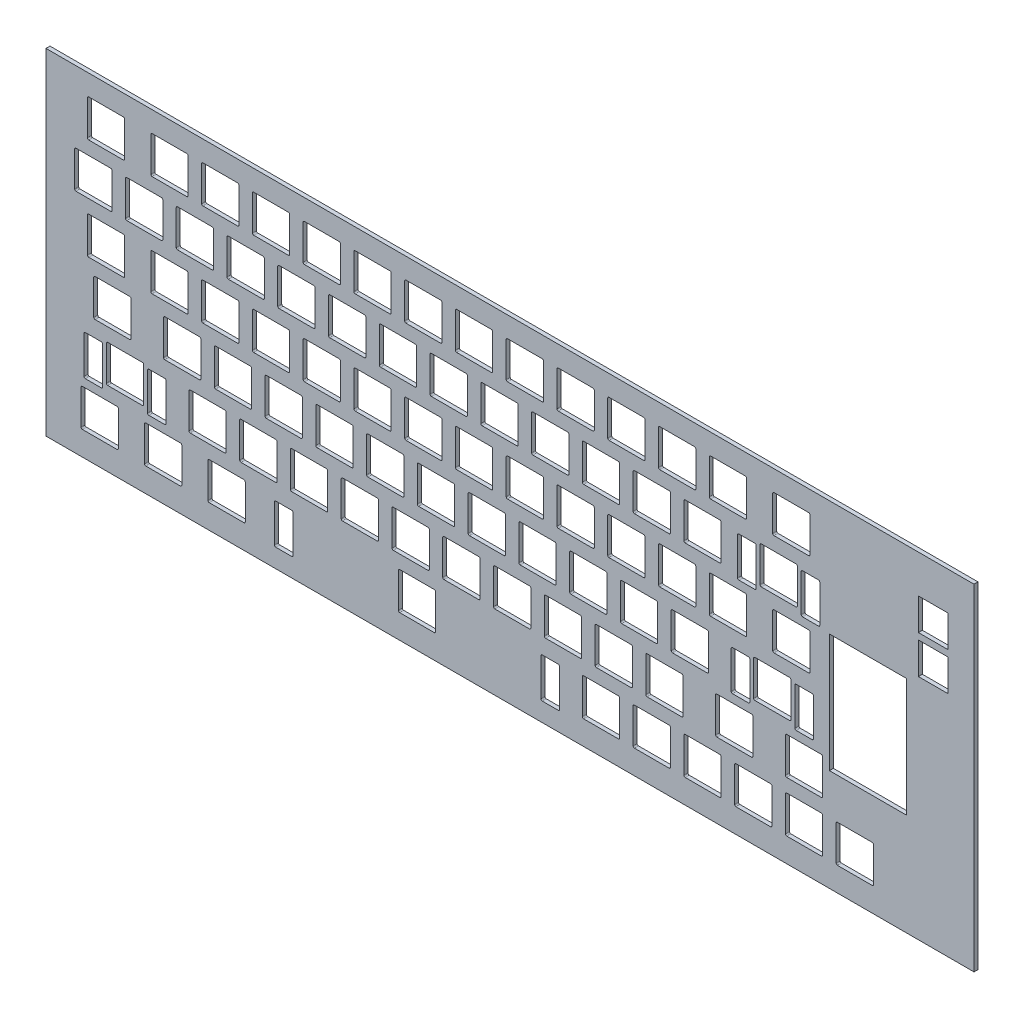
from build123d import *

# Parameters (mm, degrees)
SKETCH6_W           = 340
SKETCH6_H           = 114.3
SKETCH6_W_2         = 29
SKETCH6_H_2         = 44.42
SKETCH6_W_3         = 11.05
SKETCH6_H_3         = 11.9
BOSS_EXTRUDE4_DEPTH = 1.5
SKETCH7_W           = 1.5
SKETCH7_H           = 114.3
BOSS_EXTRUDE5_DEPTH = 8.24
SKETCH8_W           = 348.24
SKETCH8_H           = 1.5
BOSS_EXTRUDE6_DEPTH = 6.48
SKETCH9_W           = 348.24
SKETCH9_H           = 1.5
BOSS_EXTRUDE7_DEPTH = 5.23


with BuildPart() as part:
    # Sketch6 → Boss-Extrude4 (new body)
    with BuildSketch(Plane.XY):
        with Locations((170, -57.15)):
            Rectangle(SKETCH6_W, SKETCH6_H)
        with BuildLine():
            Line((7.7875, -2.525), (20.7875, -2.525))
            ThreePointArc((20.7875, -2.525), (21.141053391, -2.671446609), (21.2875, -3.025))
            Line((21.2875, -3.025), (21.2875, -16.025))
            ThreePointArc((21.2875, -16.025), (21.141053391, -16.378553391), (20.7875, -16.525))
            Line((20.7875, -16.525), (7.7875, -16.525))
            ThreePointArc((7.7875, -16.525), (7.433946609, -16.378553391), (7.2875, -16.025))
            Line((7.2875, -16.025), (7.2875, -3.025))
            ThreePointArc((7.2875, -3.025), (7.433946609, -2.671446609), (7.7875, -2.525))
        make_face(mode=Mode.SUBTRACT)
        with BuildLine():
            Line((31.6, -2.525), (44.6, -2.525))
            ThreePointArc((44.6, -2.525), (44.953553391, -2.671446609), (45.1, -3.025))
            Line((45.1, -3.025), (45.1, -16.025))
            ThreePointArc((45.1, -16.025), (44.953553391, -16.378553391), (44.6, -16.525))
            Line((44.6, -16.525), (31.6, -16.525))
            ThreePointArc((31.6, -16.525), (31.246446609, -16.378553391), (31.1, -16.025))
            Line((31.1, -16.025), (31.1, -3.025))
            ThreePointArc((31.1, -3.025), (31.246446609, -2.671446609), (31.6, -2.525))
        make_face(mode=Mode.SUBTRACT)
        with BuildLine():
            Line((50.65, -2.525), (63.65, -2.525))
            ThreePointArc((63.65, -2.525), (64.003553391, -2.671446609), (64.15, -3.025))
            Line((64.15, -3.025), (64.15, -16.025))
            ThreePointArc((64.15, -16.025), (64.003553391, -16.378553391), (63.65, -16.525))
            Line((63.65, -16.525), (50.65, -16.525))
            ThreePointArc((50.65, -16.525), (50.296446609, -16.378553391), (50.15, -16.025))
            Line((50.15, -16.025), (50.15, -3.025))
            ThreePointArc((50.15, -3.025), (50.296446609, -2.671446609), (50.65, -2.525))
        make_face(mode=Mode.SUBTRACT)
        with BuildLine():
            Line((69.7, -2.525), (82.7, -2.525))
            ThreePointArc((82.7, -2.525), (83.053553391, -2.671446609), (83.2, -3.025))
            Line((83.2, -3.025), (83.2, -16.025))
            ThreePointArc((83.2, -16.025), (83.053553391, -16.378553391), (82.7, -16.525))
            Line((82.7, -16.525), (69.7, -16.525))
            ThreePointArc((69.7, -16.525), (69.346446609, -16.378553391), (69.2, -16.025))
            Line((69.2, -16.025), (69.2, -3.025))
            ThreePointArc((69.2, -3.025), (69.346446609, -2.671446609), (69.7, -2.525))
        make_face(mode=Mode.SUBTRACT)
        with BuildLine():
            Line((88.75, -2.525), (101.75, -2.525))
            ThreePointArc((101.75, -2.525), (102.103553391, -2.671446609), (102.25, -3.025))
            Line((102.25, -3.025), (102.25, -16.025))
            ThreePointArc((102.25, -16.025), (102.103553391, -16.378553391), (101.75, -16.525))
            Line((101.75, -16.525), (88.75, -16.525))
            ThreePointArc((88.75, -16.525), (88.396446609, -16.378553391), (88.25, -16.025))
            Line((88.25, -16.025), (88.25, -3.025))
            ThreePointArc((88.25, -3.025), (88.396446609, -2.671446609), (88.75, -2.525))
        make_face(mode=Mode.SUBTRACT)
        with BuildLine():
            Line((107.8, -2.525), (120.8, -2.525))
            ThreePointArc((120.8, -2.525), (121.153553391, -2.671446609), (121.3, -3.025))
            Line((121.3, -3.025), (121.3, -16.025))
            ThreePointArc((121.3, -16.025), (121.153553391, -16.378553391), (120.8, -16.525))
            Line((120.8, -16.525), (107.8, -16.525))
            ThreePointArc((107.8, -16.525), (107.446446609, -16.378553391), (107.3, -16.025))
            Line((107.3, -16.025), (107.3, -3.025))
            ThreePointArc((107.3, -3.025), (107.446446609, -2.671446609), (107.8, -2.525))
        make_face(mode=Mode.SUBTRACT)
        with BuildLine():
            Line((126.85, -2.525), (139.85, -2.525))
            ThreePointArc((139.85, -2.525), (140.203553391, -2.671446609), (140.35, -3.025))
            Line((140.35, -3.025), (140.35, -16.025))
            ThreePointArc((140.35, -16.025), (140.203553391, -16.378553391), (139.85, -16.525))
            Line((139.85, -16.525), (126.85, -16.525))
            ThreePointArc((126.85, -16.525), (126.496446609, -16.378553391), (126.35, -16.025))
            Line((126.35, -16.025), (126.35, -3.025))
            ThreePointArc((126.35, -3.025), (126.496446609, -2.671446609), (126.85, -2.525))
        make_face(mode=Mode.SUBTRACT)
        with BuildLine():
            Line((145.9, -2.525), (158.9, -2.525))
            ThreePointArc((158.9, -2.525), (159.253553391, -2.671446609), (159.4, -3.025))
            Line((159.4, -3.025), (159.4, -16.025))
            ThreePointArc((159.4, -16.025), (159.253553391, -16.378553391), (158.9, -16.525))
            Line((158.9, -16.525), (145.9, -16.525))
            ThreePointArc((145.9, -16.525), (145.546446609, -16.378553391), (145.4, -16.025))
            Line((145.4, -16.025), (145.4, -3.025))
            ThreePointArc((145.4, -3.025), (145.546446609, -2.671446609), (145.9, -2.525))
        make_face(mode=Mode.SUBTRACT)
        with BuildLine():
            Line((164.95, -2.525), (177.95, -2.525))
            ThreePointArc((177.95, -2.525), (178.303553391, -2.671446609), (178.45, -3.025))
            Line((178.45, -3.025), (178.45, -16.025))
            ThreePointArc((178.45, -16.025), (178.303553391, -16.378553391), (177.95, -16.525))
            Line((177.95, -16.525), (164.95, -16.525))
            ThreePointArc((164.95, -16.525), (164.596446609, -16.378553391), (164.45, -16.025))
            Line((164.45, -16.025), (164.45, -3.025))
            ThreePointArc((164.45, -3.025), (164.596446609, -2.671446609), (164.95, -2.525))
        make_face(mode=Mode.SUBTRACT)
        with BuildLine():
            Line((184, -2.525), (197, -2.525))
            ThreePointArc((197, -2.525), (197.353553391, -2.671446609), (197.5, -3.025))
            Line((197.5, -3.025), (197.5, -16.025))
            ThreePointArc((197.5, -16.025), (197.353553391, -16.378553391), (197, -16.525))
            Line((197, -16.525), (184, -16.525))
            ThreePointArc((184, -16.525), (183.646446609, -16.378553391), (183.5, -16.025))
            Line((183.5, -16.025), (183.5, -3.025))
            ThreePointArc((183.5, -3.025), (183.646446609, -2.671446609), (184, -2.525))
        make_face(mode=Mode.SUBTRACT)
        with BuildLine():
            Line((203.05, -2.525), (216.05, -2.525))
            ThreePointArc((216.05, -2.525), (216.403553391, -2.671446609), (216.55, -3.025))
            Line((216.55, -3.025), (216.55, -16.025))
            ThreePointArc((216.55, -16.025), (216.403553391, -16.378553391), (216.05, -16.525))
            Line((216.05, -16.525), (203.05, -16.525))
            ThreePointArc((203.05, -16.525), (202.696446609, -16.378553391), (202.55, -16.025))
            Line((202.55, -16.025), (202.55, -3.025))
            ThreePointArc((202.55, -3.025), (202.696446609, -2.671446609), (203.05, -2.525))
        make_face(mode=Mode.SUBTRACT)
        with BuildLine():
            Line((222.1, -2.525), (235.1, -2.525))
            ThreePointArc((235.1, -2.525), (235.453553391, -2.671446609), (235.6, -3.025))
            Line((235.6, -3.025), (235.6, -16.025))
            ThreePointArc((235.6, -16.025), (235.453553391, -16.378553391), (235.1, -16.525))
            Line((235.1, -16.525), (222.1, -16.525))
            ThreePointArc((222.1, -16.525), (221.746446609, -16.378553391), (221.6, -16.025))
            Line((221.6, -16.025), (221.6, -3.025))
            ThreePointArc((221.6, -3.025), (221.746446609, -2.671446609), (222.1, -2.525))
        make_face(mode=Mode.SUBTRACT)
        with BuildLine():
            Line((241.15, -2.525), (254.15, -2.525))
            ThreePointArc((254.15, -2.525), (254.503553391, -2.671446609), (254.65, -3.025))
            Line((254.65, -3.025), (254.65, -16.025))
            ThreePointArc((254.65, -16.025), (254.503553391, -16.378553391), (254.15, -16.525))
            Line((254.15, -16.525), (241.15, -16.525))
            ThreePointArc((241.15, -16.525), (240.796446609, -16.378553391), (240.65, -16.025))
            Line((240.65, -16.025), (240.65, -3.025))
            ThreePointArc((240.65, -3.025), (240.796446609, -2.671446609), (241.15, -2.525))
        make_face(mode=Mode.SUBTRACT)
        with BuildLine():
            Line((264.9625, -2.525), (277.9625, -2.525))
            ThreePointArc((277.9625, -2.525), (278.316053391, -2.671446609), (278.4625, -3.025))
            Line((278.4625, -3.025), (278.4625, -16.025))
            ThreePointArc((278.4625, -16.025), (278.316053391, -16.378553391), (277.9625, -16.525))
            Line((277.9625, -16.525), (264.9625, -16.525))
            ThreePointArc((264.9625, -16.525), (264.608946609, -16.378553391), (264.4625, -16.025))
            Line((264.4625, -16.025), (264.4625, -3.025))
            ThreePointArc((264.4625, -3.025), (264.608946609, -2.671446609), (264.9625, -2.525))
        make_face(mode=Mode.SUBTRACT)
        with BuildLine():
            Line((3.025, -21.575), (16.025, -21.575))
            ThreePointArc((16.025, -21.575), (16.378553391, -21.721446609), (16.525, -22.075))
            Line((16.525, -22.075), (16.525, -35.075))
            ThreePointArc((16.525, -35.075), (16.378553391, -35.428553391), (16.025, -35.575))
            Line((16.025, -35.575), (3.025, -35.575))
            ThreePointArc((3.025, -35.575), (2.671446609, -35.428553391), (2.525, -35.075))
            Line((2.525, -35.075), (2.525, -22.075))
            ThreePointArc((2.525, -22.075), (2.671446609, -21.721446609), (3.025, -21.575))
        make_face(mode=Mode.SUBTRACT)
        with BuildLine():
            Line((22.075, -21.575), (35.075, -21.575))
            ThreePointArc((35.075, -21.575), (35.428553391, -21.721446609), (35.575, -22.075))
            Line((35.575, -22.075), (35.575, -35.075))
            ThreePointArc((35.575, -35.075), (35.428553391, -35.428553391), (35.075, -35.575))
            Line((35.075, -35.575), (22.075, -35.575))
            ThreePointArc((22.075, -35.575), (21.721446609, -35.428553391), (21.575, -35.075))
            Line((21.575, -35.075), (21.575, -22.075))
            ThreePointArc((21.575, -22.075), (21.721446609, -21.721446609), (22.075, -21.575))
        make_face(mode=Mode.SUBTRACT)
        with BuildLine():
            Line((41.125, -21.575), (54.125, -21.575))
            ThreePointArc((54.125, -21.575), (54.478553391, -21.721446609), (54.625, -22.075))
            Line((54.625, -22.075), (54.625, -35.075))
            ThreePointArc((54.625, -35.075), (54.478553391, -35.428553391), (54.125, -35.575))
            Line((54.125, -35.575), (41.125, -35.575))
            ThreePointArc((41.125, -35.575), (40.771446609, -35.428553391), (40.625, -35.075))
            Line((40.625, -35.075), (40.625, -22.075))
            ThreePointArc((40.625, -22.075), (40.771446609, -21.721446609), (41.125, -21.575))
        make_face(mode=Mode.SUBTRACT)
        with BuildLine():
            Line((60.175, -21.575), (73.175, -21.575))
            ThreePointArc((73.175, -21.575), (73.528553391, -21.721446609), (73.675, -22.075))
            Line((73.675, -22.075), (73.675, -35.075))
            ThreePointArc((73.675, -35.075), (73.528553391, -35.428553391), (73.175, -35.575))
            Line((73.175, -35.575), (60.175, -35.575))
            ThreePointArc((60.175, -35.575), (59.821446609, -35.428553391), (59.675, -35.075))
            Line((59.675, -35.075), (59.675, -22.075))
            ThreePointArc((59.675, -22.075), (59.821446609, -21.721446609), (60.175, -21.575))
        make_face(mode=Mode.SUBTRACT)
        with BuildLine():
            Line((79.225, -21.575), (92.225, -21.575))
            ThreePointArc((92.225, -21.575), (92.578553391, -21.721446609), (92.725, -22.075))
            Line((92.725, -22.075), (92.725, -35.075))
            ThreePointArc((92.725, -35.075), (92.578553391, -35.428553391), (92.225, -35.575))
            Line((92.225, -35.575), (79.225, -35.575))
            ThreePointArc((79.225, -35.575), (78.871446609, -35.428553391), (78.725, -35.075))
            Line((78.725, -35.075), (78.725, -22.075))
            ThreePointArc((78.725, -22.075), (78.871446609, -21.721446609), (79.225, -21.575))
        make_face(mode=Mode.SUBTRACT)
        with BuildLine():
            Line((98.275, -21.575), (111.275, -21.575))
            ThreePointArc((111.275, -21.575), (111.628553391, -21.721446609), (111.775, -22.075))
            Line((111.775, -22.075), (111.775, -35.075))
            ThreePointArc((111.775, -35.075), (111.628553391, -35.428553391), (111.275, -35.575))
            Line((111.275, -35.575), (98.275, -35.575))
            ThreePointArc((98.275, -35.575), (97.921446609, -35.428553391), (97.775, -35.075))
            Line((97.775, -35.075), (97.775, -22.075))
            ThreePointArc((97.775, -22.075), (97.921446609, -21.721446609), (98.275, -21.575))
        make_face(mode=Mode.SUBTRACT)
        with BuildLine():
            Line((117.325, -21.575), (130.325, -21.575))
            ThreePointArc((130.325, -21.575), (130.678553391, -21.721446609), (130.825, -22.075))
            Line((130.825, -22.075), (130.825, -35.075))
            ThreePointArc((130.825, -35.075), (130.678553391, -35.428553391), (130.325, -35.575))
            Line((130.325, -35.575), (117.325, -35.575))
            ThreePointArc((117.325, -35.575), (116.971446609, -35.428553391), (116.825, -35.075))
            Line((116.825, -35.075), (116.825, -22.075))
            ThreePointArc((116.825, -22.075), (116.971446609, -21.721446609), (117.325, -21.575))
        make_face(mode=Mode.SUBTRACT)
        with BuildLine():
            Line((136.375, -21.575), (149.375, -21.575))
            ThreePointArc((149.375, -21.575), (149.728553391, -21.721446609), (149.875, -22.075))
            Line((149.875, -22.075), (149.875, -35.075))
            ThreePointArc((149.875, -35.075), (149.728553391, -35.428553391), (149.375, -35.575))
            Line((149.375, -35.575), (136.375, -35.575))
            ThreePointArc((136.375, -35.575), (136.021446609, -35.428553391), (135.875, -35.075))
            Line((135.875, -35.075), (135.875, -22.075))
            ThreePointArc((135.875, -22.075), (136.021446609, -21.721446609), (136.375, -21.575))
        make_face(mode=Mode.SUBTRACT)
        with BuildLine():
            Line((155.425, -21.575), (168.425, -21.575))
            ThreePointArc((168.425, -21.575), (168.778553391, -21.721446609), (168.925, -22.075))
            Line((168.925, -22.075), (168.925, -35.075))
            ThreePointArc((168.925, -35.075), (168.778553391, -35.428553391), (168.425, -35.575))
            Line((168.425, -35.575), (155.425, -35.575))
            ThreePointArc((155.425, -35.575), (155.071446609, -35.428553391), (154.925, -35.075))
            Line((154.925, -35.075), (154.925, -22.075))
            ThreePointArc((154.925, -22.075), (155.071446609, -21.721446609), (155.425, -21.575))
        make_face(mode=Mode.SUBTRACT)
        with BuildLine():
            Line((174.475, -21.575), (187.475, -21.575))
            ThreePointArc((187.475, -21.575), (187.828553391, -21.721446609), (187.975, -22.075))
            Line((187.975, -22.075), (187.975, -35.075))
            ThreePointArc((187.975, -35.075), (187.828553391, -35.428553391), (187.475, -35.575))
            Line((187.475, -35.575), (174.475, -35.575))
            ThreePointArc((174.475, -35.575), (174.121446609, -35.428553391), (173.975, -35.075))
            Line((173.975, -35.075), (173.975, -22.075))
            ThreePointArc((173.975, -22.075), (174.121446609, -21.721446609), (174.475, -21.575))
        make_face(mode=Mode.SUBTRACT)
        with BuildLine():
            Line((193.525, -21.575), (206.525, -21.575))
            ThreePointArc((206.525, -21.575), (206.878553391, -21.721446609), (207.025, -22.075))
            Line((207.025, -22.075), (207.025, -35.075))
            ThreePointArc((207.025, -35.075), (206.878553391, -35.428553391), (206.525, -35.575))
            Line((206.525, -35.575), (193.525, -35.575))
            ThreePointArc((193.525, -35.575), (193.171446609, -35.428553391), (193.025, -35.075))
            Line((193.025, -35.075), (193.025, -22.075))
            ThreePointArc((193.025, -22.075), (193.171446609, -21.721446609), (193.525, -21.575))
        make_face(mode=Mode.SUBTRACT)
        with BuildLine():
            Line((212.575, -21.575), (225.575, -21.575))
            ThreePointArc((225.575, -21.575), (225.928553391, -21.721446609), (226.075, -22.075))
            Line((226.075, -22.075), (226.075, -35.075))
            ThreePointArc((226.075, -35.075), (225.928553391, -35.428553391), (225.575, -35.575))
            Line((225.575, -35.575), (212.575, -35.575))
            ThreePointArc((212.575, -35.575), (212.221446609, -35.428553391), (212.075, -35.075))
            Line((212.075, -35.075), (212.075, -22.075))
            ThreePointArc((212.075, -22.075), (212.221446609, -21.721446609), (212.575, -21.575))
        make_face(mode=Mode.SUBTRACT)
        with BuildLine():
            Line((231.625, -21.575), (244.625, -21.575))
            ThreePointArc((244.625, -21.575), (244.978553391, -21.721446609), (245.125, -22.075))
            Line((245.125, -22.075), (245.125, -35.075))
            ThreePointArc((245.125, -35.075), (244.978553391, -35.428553391), (244.625, -35.575))
            Line((244.625, -35.575), (231.625, -35.575))
            ThreePointArc((231.625, -35.575), (231.271446609, -35.428553391), (231.125, -35.075))
            Line((231.125, -35.075), (231.125, -22.075))
            ThreePointArc((231.125, -22.075), (231.271446609, -21.721446609), (231.625, -21.575))
        make_face(mode=Mode.SUBTRACT)
        with BuildLine():
            Line((260.2, -21.575), (273.2, -21.575))
            ThreePointArc((273.2, -21.575), (273.553553391, -21.721446609), (273.7, -22.075))
            Line((273.7, -22.075), (273.7, -35.075))
            ThreePointArc((273.7, -35.075), (273.553553391, -35.428553391), (273.2, -35.575))
            Line((273.2, -35.575), (260.2, -35.575))
            ThreePointArc((260.2, -35.575), (259.846446609, -35.428553391), (259.7, -35.075))
            Line((259.7, -35.075), (259.7, -22.075))
            ThreePointArc((259.7, -22.075), (259.846446609, -21.721446609), (260.2, -21.575))
        make_face(mode=Mode.SUBTRACT)
        with BuildLine():
            Line((251.762, -22.575), (257.762, -22.575))
            ThreePointArc((257.762, -22.575), (258.115553391, -22.721446609), (258.262, -23.075))
            Line((258.262, -23.075), (258.262, -37.075))
            ThreePointArc((258.262, -37.075), (258.115553391, -37.428553391), (257.762, -37.575))
            Line((257.762, -37.575), (251.762, -37.575))
            ThreePointArc((251.762, -37.575), (251.408446609, -37.428553391), (251.262, -37.075))
            Line((251.262, -37.075), (251.262, -23.075))
            ThreePointArc((251.262, -23.075), (251.408446609, -22.721446609), (251.762, -22.575))
        make_face(mode=Mode.SUBTRACT)
        with BuildLine():
            Line((275.638, -22.575), (281.638, -22.575))
            ThreePointArc((281.638, -22.575), (281.991553391, -22.721446609), (282.138, -23.075))
            Line((282.138, -23.075), (282.138, -37.075))
            ThreePointArc((282.138, -37.075), (281.991553391, -37.428553391), (281.638, -37.575))
            Line((281.638, -37.575), (275.638, -37.575))
            ThreePointArc((275.638, -37.575), (275.284446609, -37.428553391), (275.138, -37.075))
            Line((275.138, -37.075), (275.138, -23.075))
            ThreePointArc((275.138, -23.075), (275.284446609, -22.721446609), (275.638, -22.575))
        make_face(mode=Mode.SUBTRACT)
        with BuildLine():
            Line((7.7875, -40.625), (20.7875, -40.625))
            ThreePointArc((20.7875, -40.625), (21.141053391, -40.771446609), (21.2875, -41.125))
            Line((21.2875, -41.125), (21.2875, -54.125))
            ThreePointArc((21.2875, -54.125), (21.141053391, -54.478553391), (20.7875, -54.625))
            Line((20.7875, -54.625), (7.7875, -54.625))
            ThreePointArc((7.7875, -54.625), (7.433946609, -54.478553391), (7.2875, -54.125))
            Line((7.2875, -54.125), (7.2875, -41.125))
            ThreePointArc((7.2875, -41.125), (7.433946609, -40.771446609), (7.7875, -40.625))
        make_face(mode=Mode.SUBTRACT)
        with BuildLine():
            Line((31.6, -40.625), (44.6, -40.625))
            ThreePointArc((44.6, -40.625), (44.953553391, -40.771446609), (45.1, -41.125))
            Line((45.1, -41.125), (45.1, -54.125))
            ThreePointArc((45.1, -54.125), (44.953553391, -54.478553391), (44.6, -54.625))
            Line((44.6, -54.625), (31.6, -54.625))
            ThreePointArc((31.6, -54.625), (31.246446609, -54.478553391), (31.1, -54.125))
            Line((31.1, -54.125), (31.1, -41.125))
            ThreePointArc((31.1, -41.125), (31.246446609, -40.771446609), (31.6, -40.625))
        make_face(mode=Mode.SUBTRACT)
        with BuildLine():
            Line((50.65, -40.625), (63.65, -40.625))
            ThreePointArc((63.65, -40.625), (64.003553391, -40.771446609), (64.15, -41.125))
            Line((64.15, -41.125), (64.15, -54.125))
            ThreePointArc((64.15, -54.125), (64.003553391, -54.478553391), (63.65, -54.625))
            Line((63.65, -54.625), (50.65, -54.625))
            ThreePointArc((50.65, -54.625), (50.296446609, -54.478553391), (50.15, -54.125))
            Line((50.15, -54.125), (50.15, -41.125))
            ThreePointArc((50.15, -41.125), (50.296446609, -40.771446609), (50.65, -40.625))
        make_face(mode=Mode.SUBTRACT)
        with BuildLine():
            Line((69.7, -40.625), (82.7, -40.625))
            ThreePointArc((82.7, -40.625), (83.053553391, -40.771446609), (83.2, -41.125))
            Line((83.2, -41.125), (83.2, -54.125))
            ThreePointArc((83.2, -54.125), (83.053553391, -54.478553391), (82.7, -54.625))
            Line((82.7, -54.625), (69.7, -54.625))
            ThreePointArc((69.7, -54.625), (69.346446609, -54.478553391), (69.2, -54.125))
            Line((69.2, -54.125), (69.2, -41.125))
            ThreePointArc((69.2, -41.125), (69.346446609, -40.771446609), (69.7, -40.625))
        make_face(mode=Mode.SUBTRACT)
        with BuildLine():
            Line((88.75, -40.625), (101.75, -40.625))
            ThreePointArc((101.75, -40.625), (102.103553391, -40.771446609), (102.25, -41.125))
            Line((102.25, -41.125), (102.25, -54.125))
            ThreePointArc((102.25, -54.125), (102.103553391, -54.478553391), (101.75, -54.625))
            Line((101.75, -54.625), (88.75, -54.625))
            ThreePointArc((88.75, -54.625), (88.396446609, -54.478553391), (88.25, -54.125))
            Line((88.25, -54.125), (88.25, -41.125))
            ThreePointArc((88.25, -41.125), (88.396446609, -40.771446609), (88.75, -40.625))
        make_face(mode=Mode.SUBTRACT)
        with BuildLine():
            Line((107.8, -40.625), (120.8, -40.625))
            ThreePointArc((120.8, -40.625), (121.153553391, -40.771446609), (121.3, -41.125))
            Line((121.3, -41.125), (121.3, -54.125))
            ThreePointArc((121.3, -54.125), (121.153553391, -54.478553391), (120.8, -54.625))
            Line((120.8, -54.625), (107.8, -54.625))
            ThreePointArc((107.8, -54.625), (107.446446609, -54.478553391), (107.3, -54.125))
            Line((107.3, -54.125), (107.3, -41.125))
            ThreePointArc((107.3, -41.125), (107.446446609, -40.771446609), (107.8, -40.625))
        make_face(mode=Mode.SUBTRACT)
        with BuildLine():
            Line((126.85, -40.625), (139.85, -40.625))
            ThreePointArc((139.85, -40.625), (140.203553391, -40.771446609), (140.35, -41.125))
            Line((140.35, -41.125), (140.35, -54.125))
            ThreePointArc((140.35, -54.125), (140.203553391, -54.478553391), (139.85, -54.625))
            Line((139.85, -54.625), (126.85, -54.625))
            ThreePointArc((126.85, -54.625), (126.496446609, -54.478553391), (126.35, -54.125))
            Line((126.35, -54.125), (126.35, -41.125))
            ThreePointArc((126.35, -41.125), (126.496446609, -40.771446609), (126.85, -40.625))
        make_face(mode=Mode.SUBTRACT)
        with BuildLine():
            Line((145.9, -40.625), (158.9, -40.625))
            ThreePointArc((158.9, -40.625), (159.253553391, -40.771446609), (159.4, -41.125))
            Line((159.4, -41.125), (159.4, -54.125))
            ThreePointArc((159.4, -54.125), (159.253553391, -54.478553391), (158.9, -54.625))
            Line((158.9, -54.625), (145.9, -54.625))
            ThreePointArc((145.9, -54.625), (145.546446609, -54.478553391), (145.4, -54.125))
            Line((145.4, -54.125), (145.4, -41.125))
            ThreePointArc((145.4, -41.125), (145.546446609, -40.771446609), (145.9, -40.625))
        make_face(mode=Mode.SUBTRACT)
        with BuildLine():
            Line((164.95, -40.625), (177.95, -40.625))
            ThreePointArc((177.95, -40.625), (178.303553391, -40.771446609), (178.45, -41.125))
            Line((178.45, -41.125), (178.45, -54.125))
            ThreePointArc((178.45, -54.125), (178.303553391, -54.478553391), (177.95, -54.625))
            Line((177.95, -54.625), (164.95, -54.625))
            ThreePointArc((164.95, -54.625), (164.596446609, -54.478553391), (164.45, -54.125))
            Line((164.45, -54.125), (164.45, -41.125))
            ThreePointArc((164.45, -41.125), (164.596446609, -40.771446609), (164.95, -40.625))
        make_face(mode=Mode.SUBTRACT)
        with BuildLine():
            Line((184, -40.625), (197, -40.625))
            ThreePointArc((197, -40.625), (197.353553391, -40.771446609), (197.5, -41.125))
            Line((197.5, -41.125), (197.5, -54.125))
            ThreePointArc((197.5, -54.125), (197.353553391, -54.478553391), (197, -54.625))
            Line((197, -54.625), (184, -54.625))
            ThreePointArc((184, -54.625), (183.646446609, -54.478553391), (183.5, -54.125))
            Line((183.5, -54.125), (183.5, -41.125))
            ThreePointArc((183.5, -41.125), (183.646446609, -40.771446609), (184, -40.625))
        make_face(mode=Mode.SUBTRACT)
        with BuildLine():
            Line((203.05, -40.625), (216.05, -40.625))
            ThreePointArc((216.05, -40.625), (216.403553391, -40.771446609), (216.55, -41.125))
            Line((216.55, -41.125), (216.55, -54.125))
            ThreePointArc((216.55, -54.125), (216.403553391, -54.478553391), (216.05, -54.625))
            Line((216.05, -54.625), (203.05, -54.625))
            ThreePointArc((203.05, -54.625), (202.696446609, -54.478553391), (202.55, -54.125))
            Line((202.55, -54.125), (202.55, -41.125))
            ThreePointArc((202.55, -41.125), (202.696446609, -40.771446609), (203.05, -40.625))
        make_face(mode=Mode.SUBTRACT)
        with BuildLine():
            Line((222.1, -40.625), (235.1, -40.625))
            ThreePointArc((235.1, -40.625), (235.453553391, -40.771446609), (235.6, -41.125))
            Line((235.6, -41.125), (235.6, -54.125))
            ThreePointArc((235.6, -54.125), (235.453553391, -54.478553391), (235.1, -54.625))
            Line((235.1, -54.625), (222.1, -54.625))
            ThreePointArc((222.1, -54.625), (221.746446609, -54.478553391), (221.6, -54.125))
            Line((221.6, -54.125), (221.6, -41.125))
            ThreePointArc((221.6, -41.125), (221.746446609, -40.771446609), (222.1, -40.625))
        make_face(mode=Mode.SUBTRACT)
        with BuildLine():
            Line((241.15, -40.625), (254.15, -40.625))
            ThreePointArc((254.15, -40.625), (254.503553391, -40.771446609), (254.65, -41.125))
            Line((254.65, -41.125), (254.65, -54.125))
            ThreePointArc((254.65, -54.125), (254.503553391, -54.478553391), (254.15, -54.625))
            Line((254.15, -54.625), (241.15, -54.625))
            ThreePointArc((241.15, -54.625), (240.796446609, -54.478553391), (240.65, -54.125))
            Line((240.65, -54.125), (240.65, -41.125))
            ThreePointArc((240.65, -41.125), (240.796446609, -40.771446609), (241.15, -40.625))
        make_face(mode=Mode.SUBTRACT)
        with BuildLine():
            Line((264.9625, -40.625), (277.9625, -40.625))
            ThreePointArc((277.9625, -40.625), (278.316053391, -40.771446609), (278.4625, -41.125))
            Line((278.4625, -41.125), (278.4625, -54.125))
            ThreePointArc((278.4625, -54.125), (278.316053391, -54.478553391), (277.9625, -54.625))
            Line((277.9625, -54.625), (264.9625, -54.625))
            ThreePointArc((264.9625, -54.625), (264.608946609, -54.478553391), (264.4625, -54.125))
            Line((264.4625, -54.125), (264.4625, -41.125))
            ThreePointArc((264.4625, -41.125), (264.608946609, -40.771446609), (264.9625, -40.625))
        make_face(mode=Mode.SUBTRACT)
        with BuildLine():
            Line((10.16875, -59.675), (23.16875, -59.675))
            ThreePointArc((23.16875, -59.675), (23.522303391, -59.821446609), (23.66875, -60.175))
            Line((23.66875, -60.175), (23.66875, -73.175))
            ThreePointArc((23.66875, -73.175), (23.522303391, -73.528553391), (23.16875, -73.675))
            Line((23.16875, -73.675), (10.16875, -73.675))
            ThreePointArc((10.16875, -73.675), (9.815196609, -73.528553391), (9.66875, -73.175))
            Line((9.66875, -73.175), (9.66875, -60.175))
            ThreePointArc((9.66875, -60.175), (9.815196609, -59.821446609), (10.16875, -59.675))
        make_face(mode=Mode.SUBTRACT)
        with BuildLine():
            Line((36.3625, -59.675), (49.3625, -59.675))
            ThreePointArc((49.3625, -59.675), (49.716053391, -59.821446609), (49.8625, -60.175))
            Line((49.8625, -60.175), (49.8625, -73.175))
            ThreePointArc((49.8625, -73.175), (49.716053391, -73.528553391), (49.3625, -73.675))
            Line((49.3625, -73.675), (36.3625, -73.675))
            ThreePointArc((36.3625, -73.675), (36.008946609, -73.528553391), (35.8625, -73.175))
            Line((35.8625, -73.175), (35.8625, -60.175))
            ThreePointArc((35.8625, -60.175), (36.008946609, -59.821446609), (36.3625, -59.675))
        make_face(mode=Mode.SUBTRACT)
        with BuildLine():
            Line((55.4125, -59.675), (68.4125, -59.675))
            ThreePointArc((68.4125, -59.675), (68.766053391, -59.821446609), (68.9125, -60.175))
            Line((68.9125, -60.175), (68.9125, -73.175))
            ThreePointArc((68.9125, -73.175), (68.766053391, -73.528553391), (68.4125, -73.675))
            Line((68.4125, -73.675), (55.4125, -73.675))
            ThreePointArc((55.4125, -73.675), (55.058946609, -73.528553391), (54.9125, -73.175))
            Line((54.9125, -73.175), (54.9125, -60.175))
            ThreePointArc((54.9125, -60.175), (55.058946609, -59.821446609), (55.4125, -59.675))
        make_face(mode=Mode.SUBTRACT)
        with BuildLine():
            Line((74.4625, -59.675), (87.4625, -59.675))
            ThreePointArc((87.4625, -59.675), (87.816053391, -59.821446609), (87.9625, -60.175))
            Line((87.9625, -60.175), (87.9625, -73.175))
            ThreePointArc((87.9625, -73.175), (87.816053391, -73.528553391), (87.4625, -73.675))
            Line((87.4625, -73.675), (74.4625, -73.675))
            ThreePointArc((74.4625, -73.675), (74.108946609, -73.528553391), (73.9625, -73.175))
            Line((73.9625, -73.175), (73.9625, -60.175))
            ThreePointArc((73.9625, -60.175), (74.108946609, -59.821446609), (74.4625, -59.675))
        make_face(mode=Mode.SUBTRACT)
        with BuildLine():
            Line((93.5125, -59.675), (106.5125, -59.675))
            ThreePointArc((106.5125, -59.675), (106.866053391, -59.821446609), (107.0125, -60.175))
            Line((107.0125, -60.175), (107.0125, -73.175))
            ThreePointArc((107.0125, -73.175), (106.866053391, -73.528553391), (106.5125, -73.675))
            Line((106.5125, -73.675), (93.5125, -73.675))
            ThreePointArc((93.5125, -73.675), (93.158946609, -73.528553391), (93.0125, -73.175))
            Line((93.0125, -73.175), (93.0125, -60.175))
            ThreePointArc((93.0125, -60.175), (93.158946609, -59.821446609), (93.5125, -59.675))
        make_face(mode=Mode.SUBTRACT)
        with BuildLine():
            Line((112.5625, -59.675), (125.5625, -59.675))
            ThreePointArc((125.5625, -59.675), (125.916053391, -59.821446609), (126.0625, -60.175))
            Line((126.0625, -60.175), (126.0625, -73.175))
            ThreePointArc((126.0625, -73.175), (125.916053391, -73.528553391), (125.5625, -73.675))
            Line((125.5625, -73.675), (112.5625, -73.675))
            ThreePointArc((112.5625, -73.675), (112.208946609, -73.528553391), (112.0625, -73.175))
            Line((112.0625, -73.175), (112.0625, -60.175))
            ThreePointArc((112.0625, -60.175), (112.208946609, -59.821446609), (112.5625, -59.675))
        make_face(mode=Mode.SUBTRACT)
        with BuildLine():
            Line((131.6125, -59.675), (144.6125, -59.675))
            ThreePointArc((144.6125, -59.675), (144.966053391, -59.821446609), (145.1125, -60.175))
            Line((145.1125, -60.175), (145.1125, -73.175))
            ThreePointArc((145.1125, -73.175), (144.966053391, -73.528553391), (144.6125, -73.675))
            Line((144.6125, -73.675), (131.6125, -73.675))
            ThreePointArc((131.6125, -73.675), (131.258946609, -73.528553391), (131.1125, -73.175))
            Line((131.1125, -73.175), (131.1125, -60.175))
            ThreePointArc((131.1125, -60.175), (131.258946609, -59.821446609), (131.6125, -59.675))
        make_face(mode=Mode.SUBTRACT)
        with BuildLine():
            Line((150.6625, -59.675), (163.6625, -59.675))
            ThreePointArc((163.6625, -59.675), (164.016053391, -59.821446609), (164.1625, -60.175))
            Line((164.1625, -60.175), (164.1625, -73.175))
            ThreePointArc((164.1625, -73.175), (164.016053391, -73.528553391), (163.6625, -73.675))
            Line((163.6625, -73.675), (150.6625, -73.675))
            ThreePointArc((150.6625, -73.675), (150.308946609, -73.528553391), (150.1625, -73.175))
            Line((150.1625, -73.175), (150.1625, -60.175))
            ThreePointArc((150.1625, -60.175), (150.308946609, -59.821446609), (150.6625, -59.675))
        make_face(mode=Mode.SUBTRACT)
        with BuildLine():
            Line((169.7125, -59.675), (182.7125, -59.675))
            ThreePointArc((182.7125, -59.675), (183.066053391, -59.821446609), (183.2125, -60.175))
            Line((183.2125, -60.175), (183.2125, -73.175))
            ThreePointArc((183.2125, -73.175), (183.066053391, -73.528553391), (182.7125, -73.675))
            Line((182.7125, -73.675), (169.7125, -73.675))
            ThreePointArc((169.7125, -73.675), (169.358946609, -73.528553391), (169.2125, -73.175))
            Line((169.2125, -73.175), (169.2125, -60.175))
            ThreePointArc((169.2125, -60.175), (169.358946609, -59.821446609), (169.7125, -59.675))
        make_face(mode=Mode.SUBTRACT)
        with BuildLine():
            Line((188.7625, -59.675), (201.7625, -59.675))
            ThreePointArc((201.7625, -59.675), (202.116053391, -59.821446609), (202.2625, -60.175))
            Line((202.2625, -60.175), (202.2625, -73.175))
            ThreePointArc((202.2625, -73.175), (202.116053391, -73.528553391), (201.7625, -73.675))
            Line((201.7625, -73.675), (188.7625, -73.675))
            ThreePointArc((188.7625, -73.675), (188.408946609, -73.528553391), (188.2625, -73.175))
            Line((188.2625, -73.175), (188.2625, -60.175))
            ThreePointArc((188.2625, -60.175), (188.408946609, -59.821446609), (188.7625, -59.675))
        make_face(mode=Mode.SUBTRACT)
        with BuildLine():
            Line((207.8125, -59.675), (220.8125, -59.675))
            ThreePointArc((220.8125, -59.675), (221.166053391, -59.821446609), (221.3125, -60.175))
            Line((221.3125, -60.175), (221.3125, -73.175))
            ThreePointArc((221.3125, -73.175), (221.166053391, -73.528553391), (220.8125, -73.675))
            Line((220.8125, -73.675), (207.8125, -73.675))
            ThreePointArc((207.8125, -73.675), (207.458946609, -73.528553391), (207.3125, -73.175))
            Line((207.3125, -73.175), (207.3125, -60.175))
            ThreePointArc((207.3125, -60.175), (207.458946609, -59.821446609), (207.8125, -59.675))
        make_face(mode=Mode.SUBTRACT)
        with BuildLine():
            Line((226.8625, -59.675), (239.8625, -59.675))
            ThreePointArc((239.8625, -59.675), (240.216053391, -59.821446609), (240.3625, -60.175))
            Line((240.3625, -60.175), (240.3625, -73.175))
            ThreePointArc((240.3625, -73.175), (240.216053391, -73.528553391), (239.8625, -73.675))
            Line((239.8625, -73.675), (226.8625, -73.675))
            ThreePointArc((226.8625, -73.675), (226.508946609, -73.528553391), (226.3625, -73.175))
            Line((226.3625, -73.175), (226.3625, -60.175))
            ThreePointArc((226.3625, -60.175), (226.508946609, -59.821446609), (226.8625, -59.675))
        make_face(mode=Mode.SUBTRACT)
        with BuildLine():
            Line((257.81875, -59.675), (270.81875, -59.675))
            ThreePointArc((270.81875, -59.675), (271.172303391, -59.821446609), (271.31875, -60.175))
            Line((271.31875, -60.175), (271.31875, -73.175))
            ThreePointArc((271.31875, -73.175), (271.172303391, -73.528553391), (270.81875, -73.675))
            Line((270.81875, -73.675), (257.81875, -73.675))
            ThreePointArc((257.81875, -73.675), (257.465196609, -73.528553391), (257.31875, -73.175))
            Line((257.31875, -73.175), (257.31875, -60.175))
            ThreePointArc((257.31875, -60.175), (257.465196609, -59.821446609), (257.81875, -59.675))
        make_face(mode=Mode.SUBTRACT)
        with BuildLine():
            Line((249.38075, -60.675), (255.38075, -60.675))
            ThreePointArc((255.38075, -60.675), (255.734303391, -60.821446609), (255.88075, -61.175))
            Line((255.88075, -61.175), (255.88075, -75.175))
            ThreePointArc((255.88075, -75.175), (255.734303391, -75.528553391), (255.38075, -75.675))
            Line((255.38075, -75.675), (249.38075, -75.675))
            ThreePointArc((249.38075, -75.675), (249.027196609, -75.528553391), (248.88075, -75.175))
            Line((248.88075, -75.175), (248.88075, -61.175))
            ThreePointArc((248.88075, -61.175), (249.027196609, -60.821446609), (249.38075, -60.675))
        make_face(mode=Mode.SUBTRACT)
        with BuildLine():
            Line((273.25675, -60.675), (279.25675, -60.675))
            ThreePointArc((279.25675, -60.675), (279.610303391, -60.821446609), (279.75675, -61.175))
            Line((279.75675, -61.175), (279.75675, -75.175))
            ThreePointArc((279.75675, -75.175), (279.610303391, -75.528553391), (279.25675, -75.675))
            Line((279.25675, -75.675), (273.25675, -75.675))
            ThreePointArc((273.25675, -75.675), (272.903196609, -75.528553391), (272.75675, -75.175))
            Line((272.75675, -75.175), (272.75675, -61.175))
            ThreePointArc((272.75675, -61.175), (272.903196609, -60.821446609), (273.25675, -60.675))
        make_face(mode=Mode.SUBTRACT)
        with BuildLine():
            Line((14.93125, -78.725), (27.93125, -78.725))
            ThreePointArc((27.93125, -78.725), (28.284803391, -78.871446609), (28.43125, -79.225))
            Line((28.43125, -79.225), (28.43125, -92.225))
            ThreePointArc((28.43125, -92.225), (28.284803391, -92.578553391), (27.93125, -92.725))
            Line((27.93125, -92.725), (14.93125, -92.725))
            ThreePointArc((14.93125, -92.725), (14.577696609, -92.578553391), (14.43125, -92.225))
            Line((14.43125, -92.225), (14.43125, -79.225))
            ThreePointArc((14.43125, -79.225), (14.577696609, -78.871446609), (14.93125, -78.725))
        make_face(mode=Mode.SUBTRACT)
        with BuildLine():
            Line((6.49325, -79.725), (12.49325, -79.725))
            ThreePointArc((12.49325, -79.725), (12.846803391, -79.871446609), (12.99325, -80.225))
            Line((12.99325, -80.225), (12.99325, -94.225))
            ThreePointArc((12.99325, -94.225), (12.846803391, -94.578553391), (12.49325, -94.725))
            Line((12.49325, -94.725), (6.49325, -94.725))
            ThreePointArc((6.49325, -94.725), (6.139696609, -94.578553391), (5.99325, -94.225))
            Line((5.99325, -94.225), (5.99325, -80.225))
            ThreePointArc((5.99325, -80.225), (6.139696609, -79.871446609), (6.49325, -79.725))
        make_face(mode=Mode.SUBTRACT)
        with BuildLine():
            Line((30.36925, -79.725), (36.36925, -79.725))
            ThreePointArc((36.36925, -79.725), (36.722803391, -79.871446609), (36.86925, -80.225))
            Line((36.86925, -80.225), (36.86925, -94.225))
            ThreePointArc((36.86925, -94.225), (36.722803391, -94.578553391), (36.36925, -94.725))
            Line((36.36925, -94.725), (30.36925, -94.725))
            ThreePointArc((30.36925, -94.725), (30.015696609, -94.578553391), (29.86925, -94.225))
            Line((29.86925, -94.225), (29.86925, -80.225))
            ThreePointArc((29.86925, -80.225), (30.015696609, -79.871446609), (30.36925, -79.725))
        make_face(mode=Mode.SUBTRACT)
        with BuildLine():
            Line((45.8875, -78.725), (58.8875, -78.725))
            ThreePointArc((58.8875, -78.725), (59.241053391, -78.871446609), (59.3875, -79.225))
            Line((59.3875, -79.225), (59.3875, -92.225))
            ThreePointArc((59.3875, -92.225), (59.241053391, -92.578553391), (58.8875, -92.725))
            Line((58.8875, -92.725), (45.8875, -92.725))
            ThreePointArc((45.8875, -92.725), (45.533946609, -92.578553391), (45.3875, -92.225))
            Line((45.3875, -92.225), (45.3875, -79.225))
            ThreePointArc((45.3875, -79.225), (45.533946609, -78.871446609), (45.8875, -78.725))
        make_face(mode=Mode.SUBTRACT)
        with BuildLine():
            Line((64.9375, -78.725), (77.9375, -78.725))
            ThreePointArc((77.9375, -78.725), (78.291053391, -78.871446609), (78.4375, -79.225))
            Line((78.4375, -79.225), (78.4375, -92.225))
            ThreePointArc((78.4375, -92.225), (78.291053391, -92.578553391), (77.9375, -92.725))
            Line((77.9375, -92.725), (64.9375, -92.725))
            ThreePointArc((64.9375, -92.725), (64.583946609, -92.578553391), (64.4375, -92.225))
            Line((64.4375, -92.225), (64.4375, -79.225))
            ThreePointArc((64.4375, -79.225), (64.583946609, -78.871446609), (64.9375, -78.725))
        make_face(mode=Mode.SUBTRACT)
        with BuildLine():
            Line((83.9875, -78.725), (96.9875, -78.725))
            ThreePointArc((96.9875, -78.725), (97.341053391, -78.871446609), (97.4875, -79.225))
            Line((97.4875, -79.225), (97.4875, -92.225))
            ThreePointArc((97.4875, -92.225), (97.341053391, -92.578553391), (96.9875, -92.725))
            Line((96.9875, -92.725), (83.9875, -92.725))
            ThreePointArc((83.9875, -92.725), (83.633946609, -92.578553391), (83.4875, -92.225))
            Line((83.4875, -92.225), (83.4875, -79.225))
            ThreePointArc((83.4875, -79.225), (83.633946609, -78.871446609), (83.9875, -78.725))
        make_face(mode=Mode.SUBTRACT)
        with BuildLine():
            Line((103.0375, -78.725), (116.0375, -78.725))
            ThreePointArc((116.0375, -78.725), (116.391053391, -78.871446609), (116.5375, -79.225))
            Line((116.5375, -79.225), (116.5375, -92.225))
            ThreePointArc((116.5375, -92.225), (116.391053391, -92.578553391), (116.0375, -92.725))
            Line((116.0375, -92.725), (103.0375, -92.725))
            ThreePointArc((103.0375, -92.725), (102.683946609, -92.578553391), (102.5375, -92.225))
            Line((102.5375, -92.225), (102.5375, -79.225))
            ThreePointArc((102.5375, -79.225), (102.683946609, -78.871446609), (103.0375, -78.725))
        make_face(mode=Mode.SUBTRACT)
        with BuildLine():
            Line((122.0875, -78.725), (135.0875, -78.725))
            ThreePointArc((135.0875, -78.725), (135.441053391, -78.871446609), (135.5875, -79.225))
            Line((135.5875, -79.225), (135.5875, -92.225))
            ThreePointArc((135.5875, -92.225), (135.441053391, -92.578553391), (135.0875, -92.725))
            Line((135.0875, -92.725), (122.0875, -92.725))
            ThreePointArc((122.0875, -92.725), (121.733946609, -92.578553391), (121.5875, -92.225))
            Line((121.5875, -92.225), (121.5875, -79.225))
            ThreePointArc((121.5875, -79.225), (121.733946609, -78.871446609), (122.0875, -78.725))
        make_face(mode=Mode.SUBTRACT)
        with BuildLine():
            Line((141.1375, -78.725), (154.1375, -78.725))
            ThreePointArc((154.1375, -78.725), (154.491053391, -78.871446609), (154.6375, -79.225))
            Line((154.6375, -79.225), (154.6375, -92.225))
            ThreePointArc((154.6375, -92.225), (154.491053391, -92.578553391), (154.1375, -92.725))
            Line((154.1375, -92.725), (141.1375, -92.725))
            ThreePointArc((141.1375, -92.725), (140.783946609, -92.578553391), (140.6375, -92.225))
            Line((140.6375, -92.225), (140.6375, -79.225))
            ThreePointArc((140.6375, -79.225), (140.783946609, -78.871446609), (141.1375, -78.725))
        make_face(mode=Mode.SUBTRACT)
        with BuildLine():
            Line((160.1875, -78.725), (173.1875, -78.725))
            ThreePointArc((173.1875, -78.725), (173.541053391, -78.871446609), (173.6875, -79.225))
            Line((173.6875, -79.225), (173.6875, -92.225))
            ThreePointArc((173.6875, -92.225), (173.541053391, -92.578553391), (173.1875, -92.725))
            Line((173.1875, -92.725), (160.1875, -92.725))
            ThreePointArc((160.1875, -92.725), (159.833946609, -92.578553391), (159.6875, -92.225))
            Line((159.6875, -92.225), (159.6875, -79.225))
            ThreePointArc((159.6875, -79.225), (159.833946609, -78.871446609), (160.1875, -78.725))
        make_face(mode=Mode.SUBTRACT)
        with BuildLine():
            Line((179.2375, -78.725), (192.2375, -78.725))
            ThreePointArc((192.2375, -78.725), (192.591053391, -78.871446609), (192.7375, -79.225))
            Line((192.7375, -79.225), (192.7375, -92.225))
            ThreePointArc((192.7375, -92.225), (192.591053391, -92.578553391), (192.2375, -92.725))
            Line((192.2375, -92.725), (179.2375, -92.725))
            ThreePointArc((179.2375, -92.725), (178.883946609, -92.578553391), (178.7375, -92.225))
            Line((178.7375, -92.225), (178.7375, -79.225))
            ThreePointArc((178.7375, -79.225), (178.883946609, -78.871446609), (179.2375, -78.725))
        make_face(mode=Mode.SUBTRACT)
        with BuildLine():
            Line((198.2875, -78.725), (211.2875, -78.725))
            ThreePointArc((211.2875, -78.725), (211.641053391, -78.871446609), (211.7875, -79.225))
            Line((211.7875, -79.225), (211.7875, -92.225))
            ThreePointArc((211.7875, -92.225), (211.641053391, -92.578553391), (211.2875, -92.725))
            Line((211.2875, -92.725), (198.2875, -92.725))
            ThreePointArc((198.2875, -92.725), (197.933946609, -92.578553391), (197.7875, -92.225))
            Line((197.7875, -92.225), (197.7875, -79.225))
            ThreePointArc((197.7875, -79.225), (197.933946609, -78.871446609), (198.2875, -78.725))
        make_face(mode=Mode.SUBTRACT)
        with BuildLine():
            Line((217.3375, -78.725), (230.3375, -78.725))
            ThreePointArc((230.3375, -78.725), (230.691053391, -78.871446609), (230.8375, -79.225))
            Line((230.8375, -79.225), (230.8375, -92.225))
            ThreePointArc((230.8375, -92.225), (230.691053391, -92.578553391), (230.3375, -92.725))
            Line((230.3375, -92.725), (217.3375, -92.725))
            ThreePointArc((217.3375, -92.725), (216.983946609, -92.578553391), (216.8375, -92.225))
            Line((216.8375, -92.225), (216.8375, -79.225))
            ThreePointArc((216.8375, -79.225), (216.983946609, -78.871446609), (217.3375, -78.725))
        make_face(mode=Mode.SUBTRACT)
        with BuildLine():
            Line((243.53125, -78.725), (256.53125, -78.725))
            ThreePointArc((256.53125, -78.725), (256.884803391, -78.871446609), (257.03125, -79.225))
            Line((257.03125, -79.225), (257.03125, -92.225))
            ThreePointArc((257.03125, -92.225), (256.884803391, -92.578553391), (256.53125, -92.725))
            Line((256.53125, -92.725), (243.53125, -92.725))
            ThreePointArc((243.53125, -92.725), (243.177696609, -92.578553391), (243.03125, -92.225))
            Line((243.03125, -92.225), (243.03125, -79.225))
            ThreePointArc((243.03125, -79.225), (243.177696609, -78.871446609), (243.53125, -78.725))
        make_face(mode=Mode.SUBTRACT)
        with BuildLine():
            Line((269.725, -78.725), (282.725, -78.725))
            ThreePointArc((282.725, -78.725), (283.078553391, -78.871446609), (283.225, -79.225))
            Line((283.225, -79.225), (283.225, -92.225))
            ThreePointArc((283.225, -92.225), (283.078553391, -92.578553391), (282.725, -92.725))
            Line((282.725, -92.725), (269.725, -92.725))
            ThreePointArc((269.725, -92.725), (269.371446609, -92.578553391), (269.225, -92.225))
            Line((269.225, -92.225), (269.225, -79.225))
            ThreePointArc((269.225, -79.225), (269.371446609, -78.871446609), (269.725, -78.725))
        make_face(mode=Mode.SUBTRACT)
        with BuildLine():
            Line((5.40625, -97.775), (18.40625, -97.775))
            ThreePointArc((18.40625, -97.775), (18.759803391, -97.921446609), (18.90625, -98.275))
            Line((18.90625, -98.275), (18.90625, -111.275))
            ThreePointArc((18.90625, -111.275), (18.759803391, -111.628553391), (18.40625, -111.775))
            Line((18.40625, -111.775), (5.40625, -111.775))
            ThreePointArc((5.40625, -111.775), (5.052696609, -111.628553391), (4.90625, -111.275))
            Line((4.90625, -111.275), (4.90625, -98.275))
            ThreePointArc((4.90625, -98.275), (5.052696609, -97.921446609), (5.40625, -97.775))
        make_face(mode=Mode.SUBTRACT)
        with BuildLine():
            Line((29.21875, -97.775), (42.21875, -97.775))
            ThreePointArc((42.21875, -97.775), (42.572303391, -97.921446609), (42.71875, -98.275))
            Line((42.71875, -98.275), (42.71875, -111.275))
            ThreePointArc((42.71875, -111.275), (42.572303391, -111.628553391), (42.21875, -111.775))
            Line((42.21875, -111.775), (29.21875, -111.775))
            ThreePointArc((29.21875, -111.775), (28.865196609, -111.628553391), (28.71875, -111.275))
            Line((28.71875, -111.275), (28.71875, -98.275))
            ThreePointArc((28.71875, -98.275), (28.865196609, -97.921446609), (29.21875, -97.775))
        make_face(mode=Mode.SUBTRACT)
        with BuildLine():
            Line((53.03125, -97.775), (66.03125, -97.775))
            ThreePointArc((66.03125, -97.775), (66.384803391, -97.921446609), (66.53125, -98.275))
            Line((66.53125, -98.275), (66.53125, -111.275))
            ThreePointArc((66.53125, -111.275), (66.384803391, -111.628553391), (66.03125, -111.775))
            Line((66.03125, -111.775), (53.03125, -111.775))
            ThreePointArc((53.03125, -111.775), (52.677696609, -111.628553391), (52.53125, -111.275))
            Line((52.53125, -111.275), (52.53125, -98.275))
            ThreePointArc((52.53125, -98.275), (52.677696609, -97.921446609), (53.03125, -97.775))
        make_face(mode=Mode.SUBTRACT)
        with BuildLine():
            Line((124.46875, -97.775), (137.46875, -97.775))
            ThreePointArc((137.46875, -97.775), (137.822303391, -97.921446609), (137.96875, -98.275))
            Line((137.96875, -98.275), (137.96875, -111.275))
            ThreePointArc((137.96875, -111.275), (137.822303391, -111.628553391), (137.46875, -111.775))
            Line((137.46875, -111.775), (124.46875, -111.775))
            ThreePointArc((124.46875, -111.775), (124.115196609, -111.628553391), (123.96875, -111.275))
            Line((123.96875, -111.275), (123.96875, -98.275))
            ThreePointArc((123.96875, -98.275), (124.115196609, -97.921446609), (124.46875, -97.775))
        make_face(mode=Mode.SUBTRACT)
        with BuildLine():
            Line((77.96875, -98.775), (83.96875, -98.775))
            ThreePointArc((83.96875, -98.775), (84.322303391, -98.921446609), (84.46875, -99.275))
            Line((84.46875, -99.275), (84.46875, -113.275))
            ThreePointArc((84.46875, -113.275), (84.322303391, -113.628553391), (83.96875, -113.775))
            Line((83.96875, -113.775), (77.96875, -113.775))
            ThreePointArc((77.96875, -113.775), (77.615196609, -113.628553391), (77.46875, -113.275))
            Line((77.46875, -113.275), (77.46875, -99.275))
            ThreePointArc((77.46875, -99.275), (77.615196609, -98.921446609), (77.96875, -98.775))
        make_face(mode=Mode.SUBTRACT)
        with BuildLine():
            Line((177.96875, -98.775), (183.96875, -98.775))
            ThreePointArc((183.96875, -98.775), (184.322303391, -98.921446609), (184.46875, -99.275))
            Line((184.46875, -99.275), (184.46875, -113.275))
            ThreePointArc((184.46875, -113.275), (184.322303391, -113.628553391), (183.96875, -113.775))
            Line((183.96875, -113.775), (177.96875, -113.775))
            ThreePointArc((177.96875, -113.775), (177.615196609, -113.628553391), (177.46875, -113.275))
            Line((177.46875, -113.275), (177.46875, -99.275))
            ThreePointArc((177.46875, -99.275), (177.615196609, -98.921446609), (177.96875, -98.775))
        make_face(mode=Mode.SUBTRACT)
        with BuildLine():
            Line((193.525, -97.775), (206.525, -97.775))
            ThreePointArc((206.525, -97.775), (206.878553391, -97.921446609), (207.025, -98.275))
            Line((207.025, -98.275), (207.025, -111.275))
            ThreePointArc((207.025, -111.275), (206.878553391, -111.628553391), (206.525, -111.775))
            Line((206.525, -111.775), (193.525, -111.775))
            ThreePointArc((193.525, -111.775), (193.171446609, -111.628553391), (193.025, -111.275))
            Line((193.025, -111.275), (193.025, -98.275))
            ThreePointArc((193.025, -98.275), (193.171446609, -97.921446609), (193.525, -97.775))
        make_face(mode=Mode.SUBTRACT)
        with BuildLine():
            Line((212.575, -97.775), (225.575, -97.775))
            ThreePointArc((225.575, -97.775), (225.928553391, -97.921446609), (226.075, -98.275))
            Line((226.075, -98.275), (226.075, -111.275))
            ThreePointArc((226.075, -111.275), (225.928553391, -111.628553391), (225.575, -111.775))
            Line((225.575, -111.775), (212.575, -111.775))
            ThreePointArc((212.575, -111.775), (212.221446609, -111.628553391), (212.075, -111.275))
            Line((212.075, -111.275), (212.075, -98.275))
            ThreePointArc((212.075, -98.275), (212.221446609, -97.921446609), (212.575, -97.775))
        make_face(mode=Mode.SUBTRACT)
        with BuildLine():
            Line((231.625, -97.775), (244.625, -97.775))
            ThreePointArc((244.625, -97.775), (244.978553391, -97.921446609), (245.125, -98.275))
            Line((245.125, -98.275), (245.125, -111.275))
            ThreePointArc((245.125, -111.275), (244.978553391, -111.628553391), (244.625, -111.775))
            Line((244.625, -111.775), (231.625, -111.775))
            ThreePointArc((231.625, -111.775), (231.271446609, -111.628553391), (231.125, -111.275))
            Line((231.125, -111.275), (231.125, -98.275))
            ThreePointArc((231.125, -98.275), (231.271446609, -97.921446609), (231.625, -97.775))
        make_face(mode=Mode.SUBTRACT)
        with BuildLine():
            Line((250.675, -97.775), (263.675, -97.775))
            ThreePointArc((263.675, -97.775), (264.028553391, -97.921446609), (264.175, -98.275))
            Line((264.175, -98.275), (264.175, -111.275))
            ThreePointArc((264.175, -111.275), (264.028553391, -111.628553391), (263.675, -111.775))
            Line((263.675, -111.775), (250.675, -111.775))
            ThreePointArc((250.675, -111.775), (250.321446609, -111.628553391), (250.175, -111.275))
            Line((250.175, -111.275), (250.175, -98.275))
            ThreePointArc((250.175, -98.275), (250.321446609, -97.921446609), (250.675, -97.775))
        make_face(mode=Mode.SUBTRACT)
        with BuildLine():
            Line((269.725, -97.775), (282.725, -97.775))
            ThreePointArc((282.725, -97.775), (283.078553391, -97.921446609), (283.225, -98.275))
            Line((283.225, -98.275), (283.225, -111.275))
            ThreePointArc((283.225, -111.275), (283.078553391, -111.628553391), (282.725, -111.775))
            Line((282.725, -111.775), (269.725, -111.775))
            ThreePointArc((269.725, -111.775), (269.371446609, -111.628553391), (269.225, -111.275))
            Line((269.225, -111.275), (269.225, -98.275))
            ThreePointArc((269.225, -98.275), (269.371446609, -97.921446609), (269.725, -97.775))
        make_face(mode=Mode.SUBTRACT)
        with BuildLine():
            Line((288.775, -97.775), (301.775, -97.775))
            ThreePointArc((301.775, -97.775), (302.128553391, -97.921446609), (302.275, -98.275))
            Line((302.275, -98.275), (302.275, -111.275))
            ThreePointArc((302.275, -111.275), (302.128553391, -111.628553391), (301.775, -111.775))
            Line((301.775, -111.775), (288.775, -111.775))
            ThreePointArc((288.775, -111.775), (288.421446609, -111.628553391), (288.275, -111.275))
            Line((288.275, -111.275), (288.275, -98.275))
            ThreePointArc((288.275, -98.275), (288.421446609, -97.921446609), (288.775, -97.775))
        make_face(mode=Mode.SUBTRACT)
        with Locations((300.24, -60.29)):
            Rectangle(SKETCH6_W_2, SKETCH6_H_2, mode=Mode.SUBTRACT)
        with Locations((324.665, -14.98)):
            Rectangle(SKETCH6_W_3, SKETCH6_H_3, mode=Mode.SUBTRACT)
        with Locations((324.665, -29.28)):
            Rectangle(SKETCH6_W_3, SKETCH6_H_3, mode=Mode.SUBTRACT)
    extrude(amount=BOSS_EXTRUDE4_DEPTH)

    # Sketch7 → Boss-Extrude5 (add)
    with BuildSketch(Plane.ZY):
        with Locations((0.75, -57.15)):
            Rectangle(SKETCH7_W, SKETCH7_H)
    extrude(amount=BOSS_EXTRUDE5_DEPTH)

    # Sketch8 → Boss-Extrude6 (add)
    with BuildSketch(Plane.XZ.offset(114.3)):
        with Locations((165.88, 0.75)):
            Rectangle(SKETCH8_W, SKETCH8_H)
    extrude(amount=BOSS_EXTRUDE6_DEPTH)

    # Sketch9 → Boss-Extrude7 (add)
    with BuildSketch(Plane(origin=(0, 0, 0), x_dir=(1, 0, 0), z_dir=(0, 1, 0))):
        with Locations((165.88, -0.75)):
            Rectangle(SKETCH9_W, SKETCH9_H)
    extrude(amount=BOSS_EXTRUDE7_DEPTH)


solid = part.part
